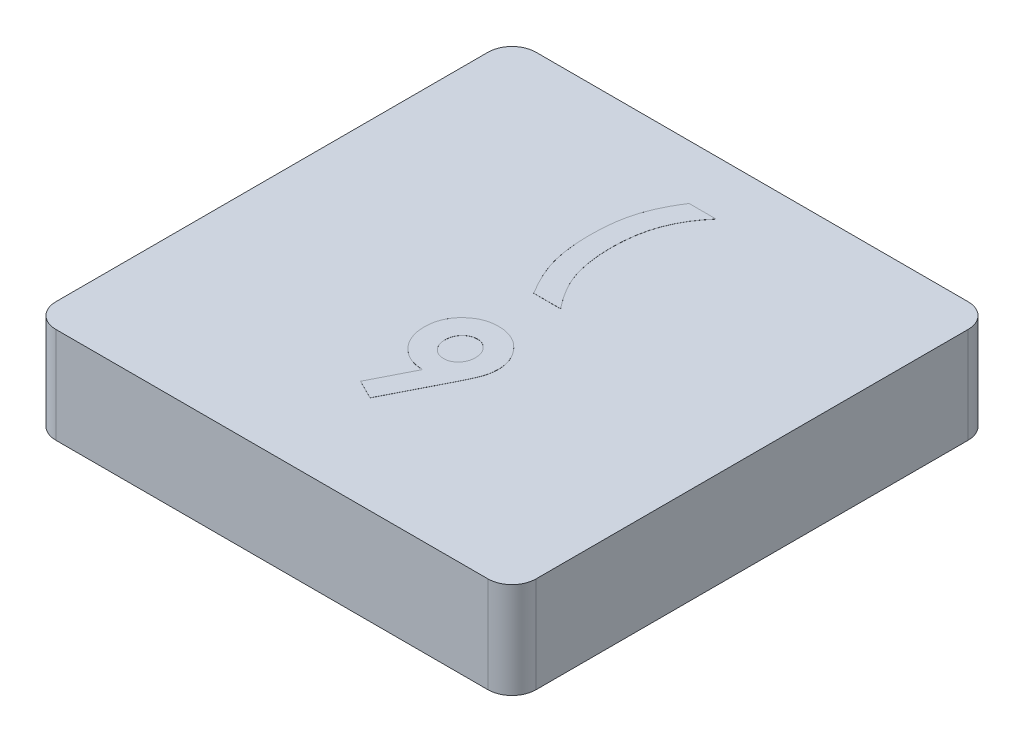
from build123d import *

# Parameters (mm, degrees)
SKETCH1_W           = 12.7
SKETCH1_H           = 12.7
BOSS_EXTRUDE1_DEPTH = 2.54
FILLET1_R           = 0.635
SHELL1_START        = 0.635
SHELL1_OUTLINE_W    = 1.905
SHELL1_OUTLINE_H    = 11.43
SHELL1_DEPTH        = 11.43
SKETCH2_R           = 2.54
BOSS_EXTRUDE2_DEPTH = 1.905
BOSS_EXTRUDE4_DEPTH = 0.00254


# Read off the part's stored shape, not the designer's step: Shell1
with BuildPart() as part:
    # Sketch1 → Boss-Extrude1 (new body)
    with BuildSketch(Plane(origin=(0, 0, 0), x_dir=(1, 0, 0), z_dir=(0, 1, 0))):
        with Locations((6.35, 6.35)):
            Rectangle(SKETCH1_W, SKETCH1_H)
    extrude(amount=BOSS_EXTRUDE1_DEPTH)

    # Fillet1
    fillet1_edges = [part.edges().sort_by_distance(p)[0] for p in [
        (0, 1.27, -12.7),
        (12.7, 1.27, -12.7),
        (12.7, 1.27, 0),
        (0, 1.27, 0),
    ]]
    fillet(fillet1_edges, radius=FILLET1_R)

    # Shell1 outline → Shell1 (cut)
    with BuildSketch(Plane.YZ.offset(SHELL1_START)):
        with Locations((0.9525, -6.35)):
            Rectangle(SHELL1_OUTLINE_W, SHELL1_OUTLINE_H)
    extrude(amount=SHELL1_DEPTH, mode=Mode.SUBTRACT)

    # Sketch2 → Boss-Extrude2 (add)
    with BuildSketch(Plane(origin=(0, 1.905, 0), x_dir=(-1, 0, 0), z_dir=(0, -1, 0))):
        with Locations(Location((-6.35, 6.35, 0), (0, 0, 270))):
            Circle(SKETCH2_R)
    extrude(amount=BOSS_EXTRUDE2_DEPTH)

    # Sketch4 → Boss-Extrude4 (add)
    # profile 1 of 2: a face of its own
    with BuildSketch(Plane(origin=(0, 2.54, 0), x_dir=(1, 0, 0), z_dir=(0, 1, 0))):
        with BuildLine():
            Line((6.359463942, 2.585589744), (5.854465946, 2.839996795))
            Line((5.854465946, 2.839996795), (6.407801282, 3.928858974))
            add(Edge.make_bspline(
                [(6.407801282, 3.928858974), (6.37510896, 3.929692258), (6.310926022, 3.931328196), (6.216421654, 3.944922824), (6.126049401, 3.968129722), (6.038744074, 3.999023949), (5.955713077, 4.040440861), (5.875949592, 4.089869773), (5.800557817, 4.1492579), (5.72918427, 4.21601261), (5.664017941, 4.289798172), (5.607454945, 4.369153296), (5.558153789, 4.452064974), (5.519814505, 4.540404997), (5.489020198, 4.632526927), (5.466520324, 4.728907598), (5.45389399, 4.829969864), (5.452129186, 4.898751737), (5.451230769, 4.933766827)],
                knots=[0, 0, 0, 0, 1.014336294, 1.991387562, 2.955278539, 3.906441712, 4.859855302, 5.829322156, 6.813833455, 7.833278715, 8.858926674, 9.863225732, 10.85404919, 11.846815163, 12.845559416, 13.865450493, 14.913355531, 16, 16, 16, 16], degree=3))
            add(Edge.make_bspline(
                [(5.451230769, 4.933766827), (5.4520641, 4.967731119), (5.45370616, 5.034657053), (5.467343628, 5.132882545), (5.48978737, 5.227193368), (5.520579382, 5.317573499), (5.561571384, 5.40341349), (5.60955148, 5.486057396), (5.66820497, 5.563795404), (5.734463459, 5.636964041), (5.80697986, 5.703900425), (5.883913674, 5.762753864), (5.964915094, 5.811949684), (6.048943173, 5.853265097), (6.137516777, 5.884133404), (6.229355921, 5.907423313), (6.325144744, 5.920864918), (6.3901642, 5.922555021), (6.423065705, 5.923410256)],
                knots=[0, 0, 0, 0, 1.055538678, 2.079917126, 3.075849687, 4.065898488, 5.041806164, 6.028602842, 7.031727914, 8.062953097, 9.093756959, 10.095582084, 11.068815425, 12.035667573, 13.000833448, 13.979119574, 14.977382875, 16, 16, 16, 16], degree=3))
            add(Edge.make_bspline(
                [(6.423065705, 5.923410256), (6.457468209, 5.922702118), (6.525116079, 5.92130966), (6.624143475, 5.905944432), (6.71888888, 5.882371363), (6.809737259, 5.850354325), (6.895560767, 5.806900578), (6.977077532, 5.754820959), (7.054016404, 5.692963174), (7.125551114, 5.623110154), (7.190611134, 5.547131925), (7.248278747, 5.467601049), (7.296721989, 5.384673031), (7.336399968, 5.299087975), (7.367308914, 5.210711801), (7.388554875, 5.119419152), (7.402659837, 5.025366142), (7.4042647, 4.961591251), (7.405076923, 4.929314704)],
                knots=[0, 0, 0, 0, 1.062826075, 2.08990367, 3.089830715, 4.078784409, 5.060762809, 6.057138927, 7.064407536, 8.107320944, 9.143871033, 10.153461498, 11.140480137, 12.108246174, 13.065926856, 14.029354859, 15.002654194, 16, 16, 16, 16], degree=3))
            add(Edge.make_bspline(
                [(7.405076923, 4.929314704), (7.404633685, 4.904698148), (7.403740905, 4.855114869), (7.39496241, 4.780759368), (7.381643664, 4.706197784), (7.36618444, 4.643509984), (7.349977595, 4.590667976), (7.334206488, 4.545841333), (7.313971695, 4.496075342), (7.291377525, 4.441036433), (7.265210817, 4.38096596), (7.234929053, 4.316151081), (7.202362379, 4.245630527), (7.178357526, 4.197409534), (7.165934295, 4.172453726)],
                knots=[0, 0, 0, 0, 1.105131805, 2.225983929, 3.357782449, 4.505488967, 5.122909461, 5.839607681, 6.638776516, 7.535249922, 8.51168636, 9.581005249, 10.748097757, 12, 12, 12, 12], degree=3))
            Line((7.165934295, 4.172453726), (6.359463942, 2.585589744))
        make_face()
        with BuildLine():
            add(Edge.make_bspline(
                [(6.435786058, 4.458025641), (6.46309194, 4.459633217), (6.516441451, 4.462774058), (6.593074476, 4.487059704), (6.661657137, 4.528619041), (6.722444439, 4.583831174), (6.772677205, 4.651192501), (6.809199713, 4.727877384), (6.831696453, 4.812297764), (6.834013104, 4.871082471), (6.835205128, 4.901329928)],
                knots=[0, 0, 0, 0, 0.984774978, 1.924027336, 2.867853169, 3.859505234, 4.871392407, 5.881338128, 6.909850265, 8, 8, 8, 8], degree=3))
            add(Edge.make_bspline(
                [(6.835205128, 4.901329928), (6.833769465, 4.932206601), (6.830976757, 4.992269104), (6.808264507, 5.078715896), (6.76945384, 5.156858669), (6.716654147, 5.224786259), (6.655011194, 5.281632973), (6.586078813, 5.323157968), (6.511530825, 5.348835693), (6.45994101, 5.351960048), (6.433878005, 5.353538462)],
                knots=[0, 0, 0, 0, 1.104110315, 2.147758178, 3.172670271, 4.206310416, 5.210906102, 6.157051016, 7.068948237, 8, 8, 8, 8], degree=3))
            add(Edge.make_bspline(
                [(6.433878005, 5.353538462), (6.406330871, 5.351999712), (6.3522423, 5.348978389), (6.274657461, 5.323362327), (6.203136419, 5.282634751), (6.140678718, 5.225595158), (6.086623972, 5.158562153), (6.048930123, 5.080155613), (6.025083687, 4.99431208), (6.022453466, 4.934141867), (6.021102564, 4.903237981)],
                knots=[0, 0, 0, 0, 0.970967322, 1.90648639, 2.855811969, 3.858352357, 4.877096915, 5.878517833, 6.91039038, 8, 8, 8, 8], degree=3))
            add(Edge.make_bspline(
                [(6.021102564, 4.903237981), (6.022513665, 4.872774607), (6.025258108, 4.813526525), (6.048259331, 4.728627364), (6.085726018, 4.651536658), (6.136945653, 4.583644091), (6.20003563, 4.528159923), (6.271669441, 4.487043277), (6.3515753, 4.462708207), (6.407210509, 4.459614594), (6.435786058, 4.458025641)],
                knots=[0, 0, 0, 0, 1.075706617, 2.092137047, 3.084482865, 4.090466434, 5.0784141, 6.035155512, 6.990809768, 8, 8, 8, 8], degree=3))
        make_face(mode=Mode.SUBTRACT)
    # profile 2 of 2: a face of its own
    with BuildSketch(Plane(origin=(0, 2.54, 0), x_dir=(1, 0, 0), z_dir=(0, 1, 0))):
        with BuildLine():
            Line((6.128386018, 11.257410256), (6.840089744, 11.257410256))
            add(Edge.make_bspline(
                [(6.840089744, 11.257410256), (6.809822419, 11.222311467), (6.749724305, 11.152620105), (6.666795677, 11.043407385), (6.58880222, 10.932667564), (6.516859259, 10.819319518), (6.450831014, 10.703557736), (6.390172367, 10.585956901), (6.336053768, 10.465927477), (6.287531103, 10.343512884), (6.244695572, 10.21769031), (6.207842411, 10.087755624), (6.176795055, 9.953583531), (6.151264275, 9.815013647), (6.131654114, 9.672170871), (6.117982965, 9.524677216), (6.108469866, 9.373014933), (6.107757668, 9.270294234), (6.107397436, 9.21833774)],
                knots=[0, 0, 0, 0, 1.00236213, 1.990267575, 2.964862165, 3.931797803, 4.893137898, 5.846900052, 6.793123604, 7.740135921, 8.694427184, 9.667077551, 10.660503013, 11.672460941, 12.714089686, 13.778281025, 14.87624668, 16, 16, 16, 16], degree=3))
            add(Edge.make_bspline(
                [(6.107397436, 9.21833774), (6.107995993, 9.162143219), (6.109175923, 9.051367583), (6.118877551, 8.887757803), (6.134923993, 8.729310145), (6.155999738, 8.575722074), (6.184973215, 8.427707126), (6.219082012, 8.284484773), (6.260167582, 8.146690387), (6.292872796, 8.057661908), (6.309015024, 8.013720353)],
                knots=[0, 0, 0, 0, 1.097990858, 2.164457195, 3.201156713, 4.209415668, 5.192484095, 6.147015238, 7.085427113, 8, 8, 8, 8], degree=3))
            add(Edge.make_bspline(
                [(6.309015024, 8.013720353), (6.322859685, 7.979852544), (6.351131554, 7.910691856), (6.401423106, 7.807609383), (6.457716212, 7.702288141), (6.521502326, 7.595201452), (6.590089423, 7.484963434), (6.66788775, 7.373996815), (6.750785957, 7.259995238), (6.809954754, 7.184594376), (6.840089744, 7.146192308)],
                knots=[0, 0, 0, 0, 0.860028042, 1.756243877, 2.695094802, 3.667075869, 4.686284936, 5.746781471, 6.852423585, 8, 8, 8, 8], degree=3))
            Line((6.840089744, 7.146192308), (6.128386018, 7.146192308))
            add(Edge.make_bspline(
                [(6.128386018, 7.146192308), (6.101555843, 7.190097535), (6.048888171, 7.276283561), (5.97672167, 7.406860871), (5.908837677, 7.533983087), (5.84863606, 7.65988857), (5.79329841, 7.782919252), (5.746285673, 7.904803232), (5.702814586, 8.023514572), (5.667008208, 8.142113651), (5.636420071, 8.262084169), (5.609358218, 8.385886124), (5.587541556, 8.514997933), (5.568864716, 8.649218102), (5.555169811, 8.788642241), (5.545088524, 8.933073848), (5.538405493, 9.082591024), (5.537822099, 9.183985488), (5.537525641, 9.235510216)],
                knots=[0, 0, 0, 0, 1.119871376, 2.19830916, 3.246961562, 4.256259542, 5.235550337, 6.182491613, 7.09917337, 7.986748165, 8.877687696, 9.793695483, 10.744317876, 11.727190303, 12.742913882, 13.793068013, 14.878522868, 16, 16, 16, 16], degree=3))
            add(Edge.make_bspline(
                [(5.537525641, 9.235510216), (5.537767643, 9.285977066), (5.538244775, 9.385478056), (5.545734032, 9.532235898), (5.556506209, 9.67432497), (5.570575435, 9.81170086), (5.590786974, 9.944167937), (5.613890789, 10.072003043), (5.641993832, 10.195063696), (5.674588264, 10.314351115), (5.712537615, 10.431354955), (5.755186155, 10.548123871), (5.803610458, 10.665231326), (5.857886642, 10.78278746), (5.916995095, 10.901297384), (5.981837867, 11.020140735), (6.052595779, 11.139162984), (6.102930607, 11.217694947), (6.128386018, 11.257410256)],
                knots=[0, 0, 0, 0, 1.13127193, 2.230428031, 3.293392423, 4.325815098, 5.325330466, 6.296707414, 7.23754678, 8.15420938, 9.068070667, 9.994306547, 10.940496973, 11.908145907, 12.896524899, 13.908929949, 14.942500703, 16, 16, 16, 16], degree=3))
        make_face()
    extrude(amount=BOSS_EXTRUDE4_DEPTH)


solid = part.part
